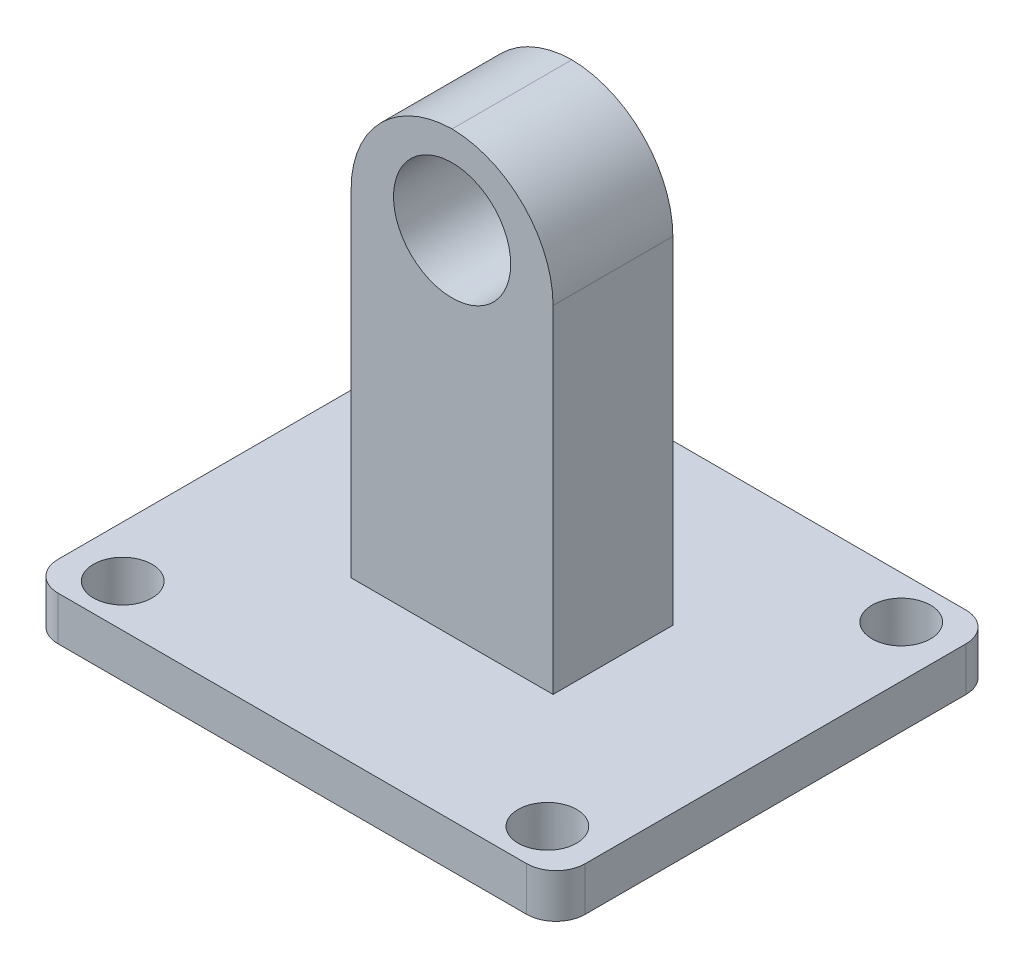
from build123d import *

# Parameters (mm, degrees)
SKETCH1_W           = 36
SKETCH1_H           = 30
BOSS_EXTRUDE1_DEPTH = 3
SKETCH2_W           = 13.789302678
SKETCH2_H           = 8.180966888
BOSS_EXTRUDE2_DEPTH = 30
FILLET1_R           = 2
FILLET2_R           = 7
SKETCH3_R           = 4
CUT_EXTRUDE1_DEPTH  = 13
SKETCH1_4_R         = 2
CUT_EXTRUDE2_DEPTH  = 4


with BuildPart() as part:
    # Sketch1 → Boss-Extrude1 (new body)
    with BuildSketch(Plane(origin=(0, 0, 0), x_dir=(1, 0, 0), z_dir=(0, 1, 0))):
        Rectangle(SKETCH1_W, SKETCH1_H)
    extrude(amount=BOSS_EXTRUDE1_DEPTH)

    # Sketch2 → Boss-Extrude2 (add)
    with BuildSketch(Plane(origin=(0, 3, 0), x_dir=(1, 0, 0), z_dir=(0, 1, 0))):
        Rectangle(SKETCH2_W, SKETCH2_H)
    extrude(amount=BOSS_EXTRUDE2_DEPTH)

    # Fillet1
    fillet1_edges = [part.edges().sort_by_distance(p)[0] for p in [
        (-18, 1.5, 15),
        (18, 1.5, 15),
        (18, 1.5, -15),
        (-18, 1.5, -15),
    ]]
    fillet(fillet1_edges, radius=FILLET1_R)

    # Fillet2
    # the kernel refuses this fillet: 7 mm, written as the material it takes off along each edge
    with BuildSketch(Plane(origin=(6.894651339, 33, 21.590483444), x_dir=(0, -1, 0), z_dir=(0, 0, -1)), Plane(origin=(-6.894651339, 33, -21.590483444), x_dir=(0, -1, 0), z_dir=(0, 0, 1))) as fillet2_piece_1:
        with BuildLine():
            CenterArc((FILLET2_R, FILLET2_R), FILLET2_R, 180, 90)
            Line((0, FILLET2_R), (0, 0))
            Line((0, 0), (FILLET2_R, 0))
        make_face()
    extrude(amount=43.180966887, mode=Mode.SUBTRACT)

    # Sketch3 → Cut-Extrude1 (cut)
    with BuildSketch(Plane.XY.offset(4.090483444)):
        with Locations((0, 27)):
            Circle(SKETCH3_R)
    extrude(amount=-CUT_EXTRUDE1_DEPTH, mode=Mode.SUBTRACT)

    # Sketch1<4> → Cut-Extrude2 (cut)
    with BuildSketch(Plane(origin=(0, 0, 0), x_dir=(1, 0, 0), z_dir=(0, 1, 0))):
        with Locations(Location((-14.5, 12.083333333, 0), (0, 0, 90))):
            Circle(SKETCH1_4_R)
        with Locations(Location((14.5, 12.083333333, 0), (0, 0, 90))):
            Circle(SKETCH1_4_R)
        with Locations(Location((14.5, -12.083333333, 0), (0, 0, 90))):
            Circle(SKETCH1_4_R)
        with Locations(Location((-14.5, -12.083333333, 0), (0, 0, 90))):
            Circle(SKETCH1_4_R)
    extrude(amount=CUT_EXTRUDE2_DEPTH, mode=Mode.SUBTRACT)


solid = part.part
